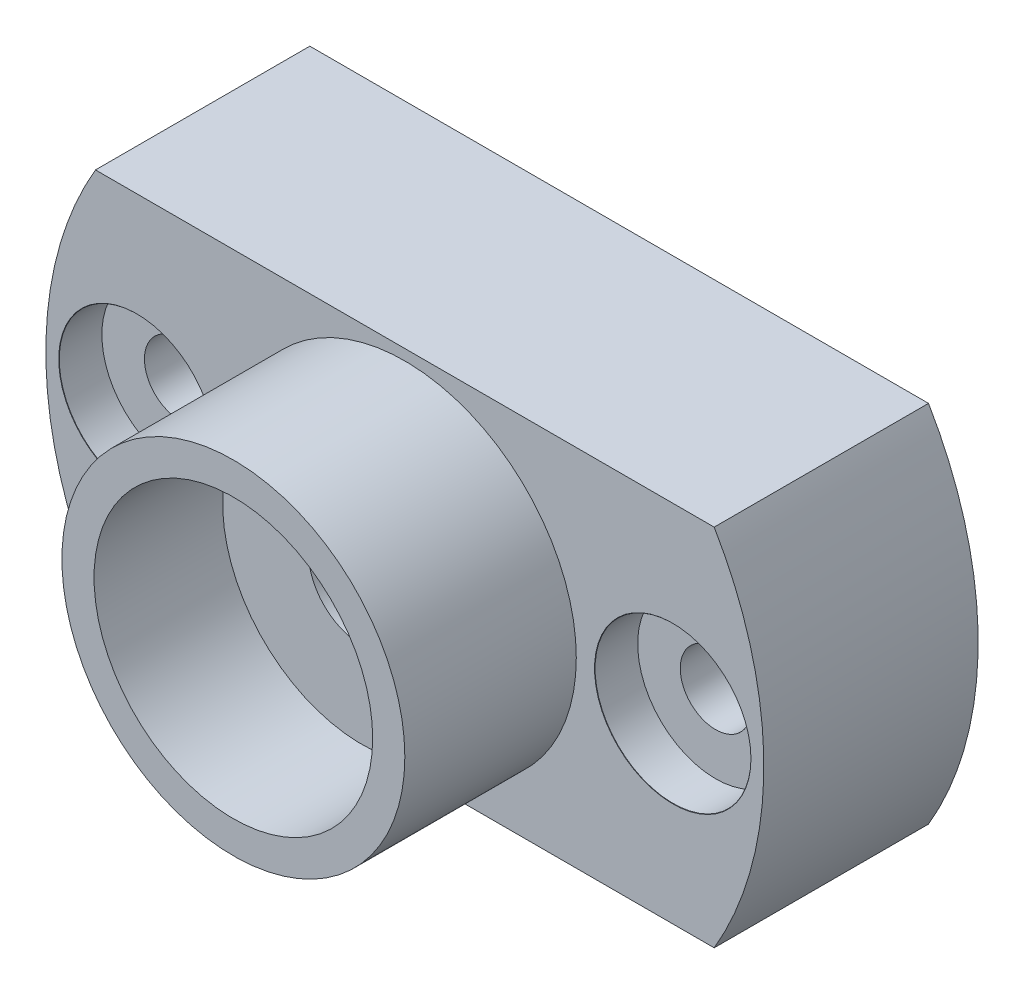
from build123d import *

# Parameters (mm, degrees)
SKETCH1_W                              = 67
SKETCH1_H                              = 34
BOSS_EXTRUDE1_DEPTH                    = 20
CUT_EXTRUDE1_START                     = -20
CUT_EXTRUDE1_DEPTH                     = 20
SKETCH3_R                              = 16
BOSS_EXTRUDE2_DEPTH                    = 16
CBORE_FOR_M6_HEX_HEAD_BOLT1_AT_2_COUNT = 2
CBORE_FOR_M6_HEX_HEAD_BOLT1_AT_2_PITCH = 50
SKETCH9_R                              = 5
CUT_EXTRUDE2_DEPTH                     = 46
SKETCH10_R                             = 13
CUT_EXTRUDE3_DEPTH                     = 12


# Read off the part's stored shape, not the designer's step: Cut-Extrude1
with BuildPart() as part:
    # Sketch1 → Boss-Extrude1 (new body)
    with BuildSketch(Plane.XY):
        Rectangle(SKETCH1_W, SKETCH1_H)
    extrude(amount=BOSS_EXTRUDE1_DEPTH)

    # Cut-Extrude1 outline → Cut-Extrude1 (cut)
    with BuildSketch(Plane.XY.offset(20).offset(CUT_EXTRUDE1_START)):
        with BuildLine():
            ThreePointArc((-33.5, -3.1e-08), (-32.320762268, 8.810126358), (-28.866070048, 17))
            Line((-28.866070048, 17), (-33.5, 17))
            Line((-33.5, 17), (-33.5, -3.1e-08))
        make_face()
        with BuildLine():
            ThreePointArc((-28.866070048, -17), (-32.32076226, -8.810126387), (-33.5, -3.1e-08))
            Line((-33.5, -3.1e-08), (-33.5, -17))
            Line((-33.5, -17), (-28.866070048, -17))
        make_face()
        with BuildLine():
            Line((33.5, 17), (28.866070048, 17))
            ThreePointArc((28.866070048, 17), (32.32076226, 8.810126387), (33.5, 3.1e-08))
            Line((33.5, 3.1e-08), (33.5, 17))
        make_face()
        with BuildLine():
            Line((33.5, -17), (33.5, 3.1e-08))
            ThreePointArc((33.5, 3.1e-08), (32.320762268, -8.810126358), (28.866070048, -17))
            Line((28.866070048, -17), (33.5, -17))
        make_face()
    extrude(amount=CUT_EXTRUDE1_DEPTH, mode=Mode.SUBTRACT)

    # Sketch3 → Boss-Extrude2 (add)
    with BuildSketch(Plane.XY.offset(20)):
        Circle(SKETCH3_R)
    extrude(amount=BOSS_EXTRUDE2_DEPTH)

    # Sketch8 → CBORE for M6 Hex Head Bolt1 (revolve, cut)
    with BuildSketch(Plane(origin=(-25, 0, 20), x_dir=(0, -1, 0), z_dir=(1, 0, 0))):
        Polygon((0, 0), (0, 20), (3.3, 20), (3.3, 4), (7.2735, 4), (7.2735, 0.025), (7.2985, 0), align=None)
    cbore_for_m6_hex_head_bolt1 = revolve(axis=Axis((-25, 0, 26.35), (0, 0, -1)), mode=Mode.SUBTRACT)

    # CBORE for M6 Hex Head Bolt1 at 2: CBORE for M6 Hex Head Bolt1 ×2
    with Locations(*[(i * CBORE_FOR_M6_HEX_HEAD_BOLT1_AT_2_PITCH, 0, 0) for i in range(1, CBORE_FOR_M6_HEX_HEAD_BOLT1_AT_2_COUNT)]):
        add(cbore_for_m6_hex_head_bolt1, mode=Mode.SUBTRACT)

    # Sketch9 → Cut-Extrude2 (cut)
    with BuildSketch(Plane.XY.offset(36)):
        Circle(SKETCH9_R)
    extrude(amount=-CUT_EXTRUDE2_DEPTH, mode=Mode.SUBTRACT)

    # Sketch10 → Cut-Extrude3 (cut)
    with BuildSketch(Plane.XY.offset(36)):
        Circle(SKETCH10_R)
    extrude(amount=-CUT_EXTRUDE3_DEPTH, mode=Mode.SUBTRACT)


solid = part.part
